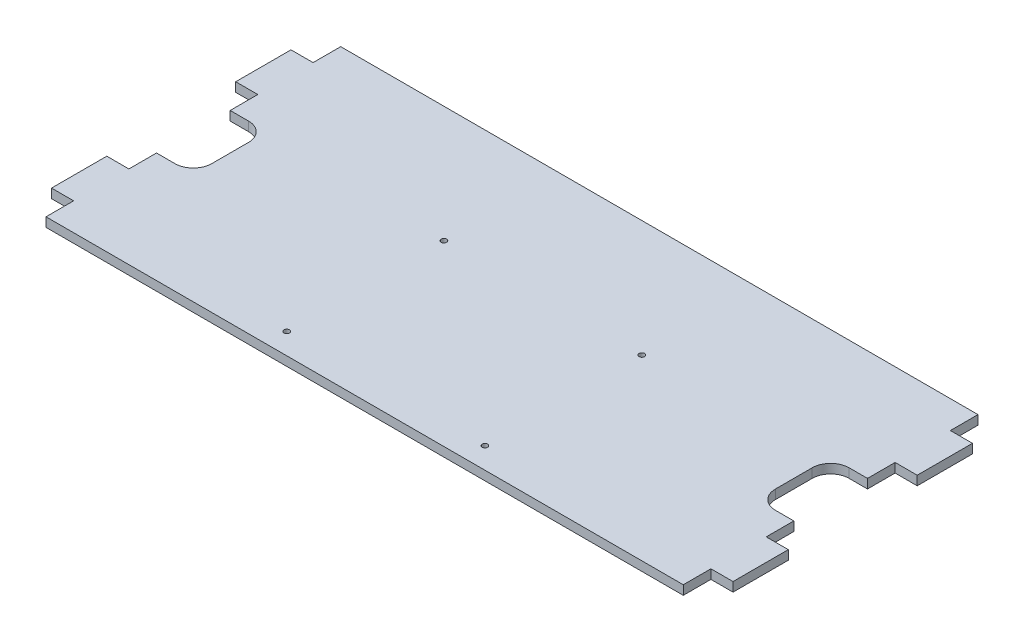
from build123d import *

# Parameters (mm, degrees)
EXTRUDE_1_DEPTH     = 5
SKETCH_2_R          = 1.5
CUT_EXTRUDE_1_DEPTH = 202.618451537


with BuildPart() as part:
    # 草圖1 → 填料-伸長1 (new body)
    with BuildSketch(Plane(origin=(0, 0, 0), x_dir=(1, 0, 0), z_dir=(0, 1, 0))):
        Polygon((173, -65), (185, -65), (185, -35), (173, -35), (173, 35), (185, 35), (185, 65), (173, 65), (173, 80), (-173, 80), (-173, 65), (-185, 65), (-185, 35), (-173, 35), (-173, -35), (-185, -35), (-185, -65), (-173, -65), (-173, -80), (173, -80), align=None)
    extrude(amount=EXTRUDE_1_DEPTH)

    # 草圖2 → 除料-伸長1 (cut, through all)
    with BuildSketch(Plane(origin=(0, 5, 0), x_dir=(1, 0, 0), z_dir=(0, 1, 0))):
        with Locations((-53.75, 16.75)):
            Circle(SKETCH_2_R)
        with Locations((53.75, 16.75)):
            Circle(SKETCH_2_R)
        with Locations((53.75, -68.5)):
            Circle(SKETCH_2_R)
        with Locations((-53.75, -68.5)):
            Circle(SKETCH_2_R)
        with BuildLine():
            Line((-173, -20), (-163, -20))
            ThreePointArc((-163, -20), (-155.928932188, -17.071067812), (-153, -10))
            Line((-153, -10), (-153, 10))
            ThreePointArc((-153, 10), (-155.928932188, 17.071067812), (-163, 20))
            Line((-163, 20), (-173, 20))
            Line((-173, 20), (-173, -20))
        make_face()
        with BuildLine():
            Line((173, 20), (163, 20))
            ThreePointArc((163, 20), (155.928932188, 17.071067812), (153, 10))
            Line((153, 10), (153, -10))
            ThreePointArc((153, -10), (155.928932188, -17.071067812), (163, -20))
            Line((163, -20), (173, -20))
            Line((173, -20), (173, 20))
        make_face()
    extrude(amount=-CUT_EXTRUDE_1_DEPTH, mode=Mode.SUBTRACT)


solid = part.part
